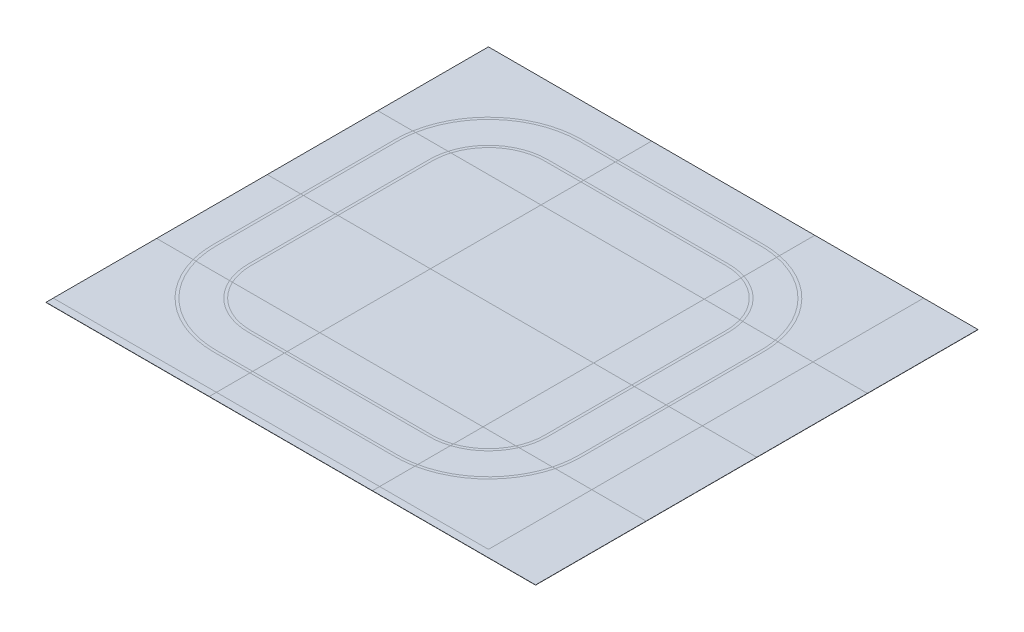
from build123d import *

# Parameters (mm, degrees)
SKETCH1_W           = 5400
SKETCH1_H           = 4880
BOSS_EXTRUDE1_DEPTH = 2
SPLIT1_START        = 900
SPLIT1_OUTLINE_W    = 2
SPLIT1_OUTLINE_H    = 1220
SPLIT1_DEPTH        = 1800
SPLIT1_2_OUTLINE_W  = 2
SPLIT1_2_OUTLINE_H  = 1220
SPLIT1_2_DEPTH      = 1800
SPLIT1_3_OUTLINE_W  = 2
SPLIT1_3_OUTLINE_H  = 1220
SPLIT1_3_DEPTH      = 1800
SPLIT1_START_2      = 1220
SPLIT1_4_OUTLINE_W  = 1800
SPLIT1_4_OUTLINE_H  = 2
SPLIT1_4_DEPTH      = 1220
SPLIT1_5_OUTLINE_W  = 2
SPLIT1_5_OUTLINE_H  = 1220
SPLIT1_5_DEPTH      = 1800
SPLIT1_START_3      = -2700
SPLIT1_6_OUTLINE_W  = 2
SPLIT1_6_OUTLINE_H  = 3660
SPLIT1_6_DEPTH      = 5400
SPLIT1_7_OUTLINE_W  = 2
SPLIT1_7_OUTLINE_H  = 1220
SPLIT1_7_DEPTH      = 1800
SPLIT1_8_OUTLINE_W  = 2
SPLIT1_8_OUTLINE_H  = 1220
SPLIT1_8_DEPTH      = 1800
SPLIT1_9_OUTLINE_W  = 1800
SPLIT1_9_OUTLINE_H  = 2
SPLIT1_9_DEPTH      = 1220
SPLIT1_START_4      = -900
SPLIT1_10_OUTLINE_W = 2
SPLIT1_10_OUTLINE_H = 1220
SPLIT1_10_DEPTH     = 1800
SPLIT1_START_5      = -1220
SPLIT1_11_OUTLINE_W = 1800
SPLIT1_11_OUTLINE_H = 2
SPLIT1_11_DEPTH     = 1220
SPLIT1_12_OUTLINE_W = 1800
SPLIT1_12_OUTLINE_H = 2
SPLIT1_12_DEPTH     = 1220
SPLIT1_13_OUTLINE_W = 1800
SPLIT1_13_OUTLINE_H = 2
SPLIT1_13_DEPTH     = 1220
SPLIT1_START_6      = -2440
SPLIT1_14_OUTLINE_W = 1800
SPLIT1_14_OUTLINE_H = 2
SPLIT1_14_DEPTH     = 1220


# Read off the part's stored shape, not the designer's step: Split1
with BuildPart() as part:
    # Sketch1 → Boss-Extrude1 (new body)
    with BuildSketch(Plane(origin=(0, 0, 0), x_dir=(1, 0, 0), z_dir=(0, 1, 0))):
        Rectangle(SKETCH1_W, SKETCH1_H)
    extrude(amount=BOSS_EXTRUDE1_DEPTH)

    # Split1 6 outline → Split1 6 (cut)
    with BuildSketch(Plane.YZ.offset(SPLIT1_START_3)):
        with Locations((1, 610)):
            Rectangle(SPLIT1_6_OUTLINE_W, SPLIT1_6_OUTLINE_H)
    extrude(amount=SPLIT1_6_DEPTH, mode=Mode.SUBTRACT)

    # Split1 7 outline → Split1 7 (cut)
    with BuildSketch(Plane.YZ.offset(SPLIT1_START_3)):
        with Locations((1, -1830)):
            Rectangle(SPLIT1_7_OUTLINE_W, SPLIT1_7_OUTLINE_H)
    extrude(amount=SPLIT1_7_DEPTH, mode=Mode.SUBTRACT)

    # Split1 8 outline → Split1 8 (cut)
    with BuildSketch(Plane.YZ.offset(SPLIT1_START)):
        with Locations((1, -1830)):
            Rectangle(SPLIT1_8_OUTLINE_W, SPLIT1_8_OUTLINE_H)
    extrude(amount=SPLIT1_8_DEPTH, mode=Mode.SUBTRACT)


with BuildPart() as body_2:
    # Split1 outline → Split1 (new body)
    with BuildSketch(Plane.YZ.offset(SPLIT1_START)):
        with Locations((1, -1830)):
            Rectangle(SPLIT1_OUTLINE_W, SPLIT1_OUTLINE_H)
    extrude(amount=SPLIT1_DEPTH)


with BuildPart() as body_3:
    # Split1 2 outline → Split1 2 (new body)
    with BuildSketch(Plane.YZ.offset(SPLIT1_START)):
        with Locations((1, 1830)):
            Rectangle(SPLIT1_2_OUTLINE_W, SPLIT1_2_OUTLINE_H)
    extrude(amount=SPLIT1_2_DEPTH)


with BuildPart() as body_4:
    # Split1 3 outline → Split1 3 (new body)
    with BuildSketch(Plane.YZ.offset(SPLIT1_START)):
        with Locations((1, 610)):
            Rectangle(SPLIT1_3_OUTLINE_W, SPLIT1_3_OUTLINE_H)
    extrude(amount=SPLIT1_3_DEPTH)


with BuildPart() as body_5:
    # Split1 4 outline → Split1 4 (new body)
    with BuildSketch(Plane.XY.offset(SPLIT1_START_2)):
        with Locations((-1800, 1)):
            Rectangle(SPLIT1_4_OUTLINE_W, SPLIT1_4_OUTLINE_H)
    extrude(amount=SPLIT1_4_DEPTH)


with BuildPart() as body_6:
    # Split1 5 outline → Split1 5 (new body)
    with BuildSketch(Plane.YZ.offset(SPLIT1_START)):
        with Locations((1, -610)):
            Rectangle(SPLIT1_5_OUTLINE_W, SPLIT1_5_OUTLINE_H)
    extrude(amount=SPLIT1_5_DEPTH)


with BuildPart() as body_7:
    # Split1 9 outline → Split1 9 (new body)
    with BuildSketch(Plane.XY):
        with Locations((-1800, 1)):
            Rectangle(SPLIT1_9_OUTLINE_W, SPLIT1_9_OUTLINE_H)
    extrude(amount=SPLIT1_9_DEPTH)


with BuildPart() as body_8:
    # Split1 10 outline → Split1 10 (new body)
    with BuildSketch(Plane.YZ.offset(SPLIT1_START_4)):
        with Locations((1, 1830)):
            Rectangle(SPLIT1_10_OUTLINE_W, SPLIT1_10_OUTLINE_H)
    extrude(amount=SPLIT1_10_DEPTH)


with BuildPart() as body_9:
    # Split1 11 outline → Split1 11 (new body)
    with BuildSketch(Plane.XY.offset(SPLIT1_START_5)):
        with Locations((-1800, 1)):
            Rectangle(SPLIT1_11_OUTLINE_W, SPLIT1_11_OUTLINE_H)
    extrude(amount=SPLIT1_11_DEPTH)


with BuildPart() as body_10:
    # Split1 12 outline → Split1 12 (new body)
    with BuildSketch(Plane.XY):
        with Locations((0, 1)):
            Rectangle(SPLIT1_12_OUTLINE_W, SPLIT1_12_OUTLINE_H)
    extrude(amount=SPLIT1_12_DEPTH)


with BuildPart() as body_11:
    # Split1 13 outline → Split1 13 (new body)
    with BuildSketch(Plane.XY.offset(SPLIT1_START_5)):
        with Locations((0, 1)):
            Rectangle(SPLIT1_13_OUTLINE_W, SPLIT1_13_OUTLINE_H)
    extrude(amount=SPLIT1_13_DEPTH)


with BuildPart() as body_12:
    # Split1 14 outline → Split1 14 (new body)
    with BuildSketch(Plane.XY.offset(SPLIT1_START_6)):
        with Locations((-1800, 1)):
            Rectangle(SPLIT1_14_OUTLINE_W, SPLIT1_14_OUTLINE_H)
    extrude(amount=SPLIT1_14_DEPTH)


solid = Compound([part.part, body_2.part, body_3.part, body_4.part, body_5.part, body_6.part, body_7.part, body_8.part, body_9.part, body_10.part, body_11.part, body_12.part])
